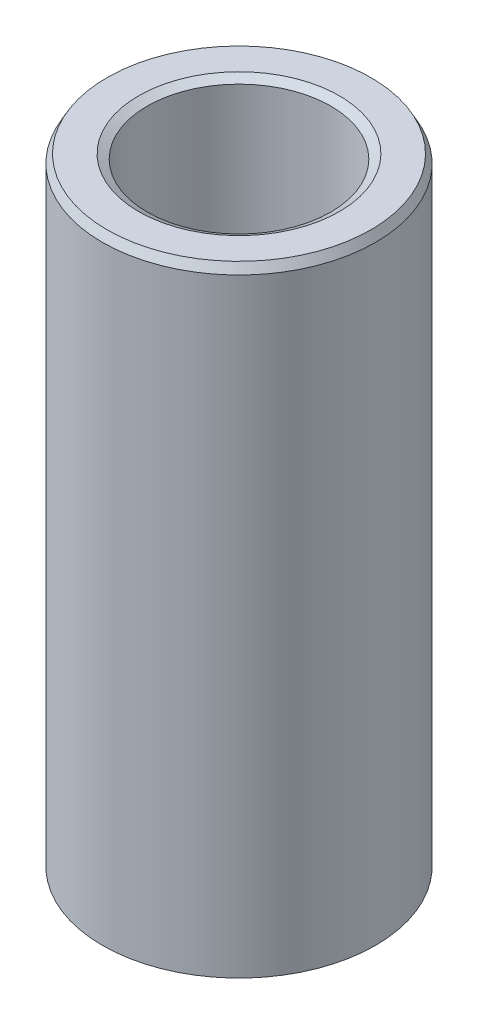
from build123d import *
from OCP.BRepFilletAPI import BRepFilletAPI_MakeChamfer

# Parameters (mm, degrees)
SKETCH1_R           = 35
BOSS_EXTRUDE1_DEPTH = 159.440543099
SKETCH2_R           = 23.53518713
CUT_EXTRUDE1_DEPTH  = 167.946957994
CHAMFER1_SIZE       = 2.186782338
CHAMFER1_SIZE2      = 1.197761012


with BuildPart() as part:
    # Sketch1 → Boss-Extrude1 (new body)
    with BuildSketch(Plane(origin=(0, 0, 0), x_dir=(1, 0, 0), z_dir=(0, 1, 0))):
        Circle(SKETCH1_R)
    extrude(amount=BOSS_EXTRUDE1_DEPTH)

    # Sketch2 → Cut-Extrude1 (cut, through all)
    with BuildSketch(Plane(origin=(0, 0, 0), x_dir=(1, 0, 0), z_dir=(0, 1, 0))):
        Circle(SKETCH2_R)
    extrude(amount=CUT_EXTRUDE1_DEPTH, mode=Mode.SUBTRACT)

    # Chamfer1: one chamfer whose edges measure the first distance from different faces: ONE call of the kernel's chamfer builder (chamfer() names one face for all edges)
    chamfer1_edges_1 = [part.edges().sort_by_distance(p)[0] for p in [
        (-23.53518713, 159.440543099, 0),
    ]]
    chamfer1_side_1 = [part.faces().sort_by_distance(p)[0] for p in [
        (-34.010050506, 159.440543099, 0),
    ]]
    chamfer1_edges_2 = [part.edges().sort_by_distance(p)[0] for p in [
        (-23.53518713, 0, 0),
    ]]
    chamfer1_side_2 = [part.faces().sort_by_distance(p)[0] for p in [
        (-23.53518713, 79.720271549, 0),
    ]]
    chamfer1_edges_3 = [part.edges().sort_by_distance(p)[0] for p in [
        (-35, 0, 0),
    ]]
    chamfer1_side_3 = [part.faces().sort_by_distance(p)[0] for p in [
        (-34.010050506, 0, 0),
    ]]
    chamfer1_edges_4 = [part.edges().sort_by_distance(p)[0] for p in [
        (-35, 159.440543099, 0),
    ]]
    chamfer1_side_4 = [part.faces().sort_by_distance(p)[0] for p in [
        (-35, 79.720271549, 0),
    ]]
    chamfer1 = BRepFilletAPI_MakeChamfer(part.part.solid().wrapped)
    for e in chamfer1_edges_1:
        chamfer1.Add(CHAMFER1_SIZE, CHAMFER1_SIZE2, e.wrapped, chamfer1_side_1[0].wrapped)  # the first distance lies on this face
    for e in chamfer1_edges_2:
        chamfer1.Add(CHAMFER1_SIZE, CHAMFER1_SIZE2, e.wrapped, chamfer1_side_2[0].wrapped)  # the first distance lies on this face
    for e in chamfer1_edges_3:
        chamfer1.Add(CHAMFER1_SIZE, CHAMFER1_SIZE2, e.wrapped, chamfer1_side_3[0].wrapped)  # the first distance lies on this face
    for e in chamfer1_edges_4:
        chamfer1.Add(CHAMFER1_SIZE, CHAMFER1_SIZE2, e.wrapped, chamfer1_side_4[0].wrapped)  # the first distance lies on this face
    add(Compound.cast(chamfer1.Shape()), mode=Mode.REPLACE)


solid = part.part
